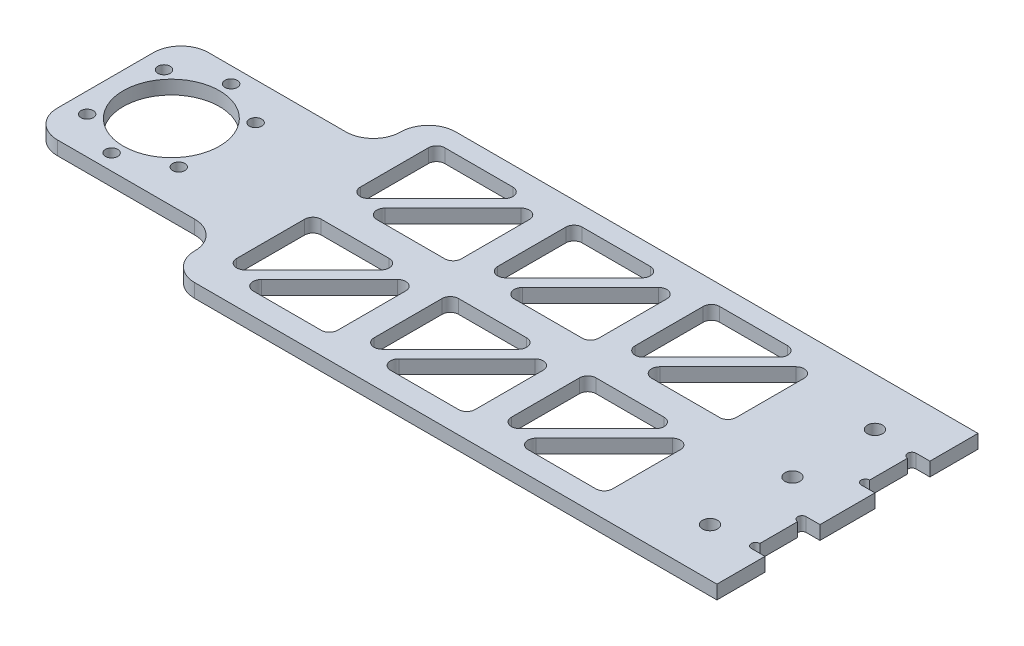
from build123d import *

# Parameters (mm, degrees)
SKETCH_1_W          = 270
SKETCH_1_H          = 5
EXTRUDE_1_DEPTH     = 95
SKETCH_2_R          = 2.25
SKETCH_2_R_2        = 17.5
CUT_EXTRUDE_1_DEPTH = 10
SKETCH_3_W          = 70
SKETCH_3_H          = 20
CUT_EXTRUDE_2_DEPTH = 10
FILLET_1_R          = 10
SKETCH_4_R          = 2.75
SKETCH_4_W          = 5
SKETCH_4_H          = 20
CUT_EXTRUDE_3_DEPTH = 10
SKETCH_5_R          = 1.55
CUT_EXTRUDE_4_DEPTH = 10


with BuildPart() as part:
    # 草图1 → 拉伸-薄壁1 (new body)
    with BuildSketch(Plane.XY):
        with Locations((-135, -2.5)):
            Rectangle(SKETCH_1_W, SKETCH_1_H)
    extrude(amount=EXTRUDE_1_DEPTH)

    # 草图2 → 切除-拉伸1 (cut)
    with BuildSketch(Plane(origin=(0, 0, 0), x_dir=(1, 0, 0), z_dir=(0, 1, 0))):
        with Locations(Location((-246, -25.75, 0), (0, 0, 270))):
            Circle(SKETCH_2_R)
        with Locations(Location((-229.338533362, -33.519369489, 0), (0, 0, 270))):
            Circle(SKETCH_2_R)
        with Locations(Location((-262.661466638, -33.519369489, 0), (0, 0, 270))):
            Circle(SKETCH_2_R)
        with Locations(Location((-262.661466638, -61.480630511, 0), (0, 0, 270))):
            Circle(SKETCH_2_R)
        with Locations(Location((-246, -69.25, 0), (0, 0, 270))):
            Circle(SKETCH_2_R)
        with Locations(Location((-229.338533362, -61.480630511, 0), (0, 0, 270))):
            Circle(SKETCH_2_R)
        with Locations(Location((-246, -47.5, 0), (0, 0, 270))):
            Circle(SKETCH_2_R_2)
    extrude(amount=-CUT_EXTRUDE_1_DEPTH, mode=Mode.SUBTRACT)

    # 草图3 → 切除-拉伸2 (cut)
    with BuildSketch(Plane(origin=(0, 0, 0), x_dir=(1, 0, 0), z_dir=(0, 1, 0))):
        with Locations((-235, -85)):
            Rectangle(SKETCH_3_W, SKETCH_3_H)
        with Locations((-235, -10)):
            Rectangle(SKETCH_3_W, SKETCH_3_H)
        with BuildLine():
            Line((-190, -10), (-190, -34.757359313))
            ThreePointArc((-190, -34.757359313), (-188.148050297, -37.52899791), (-184.878679656, -36.878679656))
            Line((-184.878679656, -36.878679656), (-160.121320344, -12.121320344))
            ThreePointArc((-160.121320344, -12.121320344), (-159.47100209, -8.851949703), (-162.242640687, -7))
            Line((-162.242640687, -7), (-187, -7))
            ThreePointArc((-187, -7), (-189.121320344, -7.878679656), (-190, -10))
        make_face()
        with BuildLine():
            Line((-154.121320344, -12.121320344), (-178.878679656, -36.878679656))
            ThreePointArc((-178.878679656, -36.878679656), (-179.52899791, -40.148050297), (-176.757359313, -42))
            Line((-176.757359313, -42), (-152, -42))
            ThreePointArc((-152, -42), (-149.878679656, -41.121320344), (-149, -39))
            Line((-149, -39), (-149, -14.242640687))
            ThreePointArc((-149, -14.242640687), (-150.851949703, -11.47100209), (-154.121320344, -12.121320344))
        make_face()
        with BuildLine():
            Line((-112.242640687, -7), (-137, -7))
            ThreePointArc((-137, -7), (-139.121320344, -7.878679656), (-140, -10))
            Line((-140, -10), (-140, -34.757359313))
            ThreePointArc((-140, -34.757359313), (-138.148050297, -37.52899791), (-134.878679656, -36.878679656))
            Line((-134.878679656, -36.878679656), (-110.121320344, -12.121320344))
            ThreePointArc((-110.121320344, -12.121320344), (-109.47100209, -8.851949703), (-112.242640687, -7))
        make_face()
        with BuildLine():
            Line((-99, -39), (-99, -14.242640687))
            ThreePointArc((-99, -14.242640687), (-100.851949703, -11.47100209), (-104.121320344, -12.121320344))
            Line((-104.121320344, -12.121320344), (-128.878679656, -36.878679656))
            ThreePointArc((-128.878679656, -36.878679656), (-129.52899791, -40.148050297), (-126.757359313, -42))
            Line((-126.757359313, -42), (-102, -42))
            ThreePointArc((-102, -42), (-99.878679656, -41.121320344), (-99, -39))
        make_face()
        with BuildLine():
            Line((-112.242640687, -52), (-137, -52))
            ThreePointArc((-137, -52), (-139.121320344, -52.878679656), (-140, -55))
            Line((-140, -55), (-140, -79.757359313))
            ThreePointArc((-140, -79.757359313), (-138.148050297, -82.52899791), (-134.878679656, -81.878679656))
            Line((-134.878679656, -81.878679656), (-110.121320344, -57.121320344))
            ThreePointArc((-110.121320344, -57.121320344), (-109.47100209, -53.851949703), (-112.242640687, -52))
        make_face()
        with BuildLine():
            Line((-99, -84), (-99, -59.242640687))
            ThreePointArc((-99, -59.242640687), (-100.851949703, -56.47100209), (-104.121320344, -57.121320344))
            Line((-104.121320344, -57.121320344), (-128.878679656, -81.878679656))
            ThreePointArc((-128.878679656, -81.878679656), (-129.52899791, -85.148050297), (-126.757359313, -87))
            Line((-126.757359313, -87), (-102, -87))
            ThreePointArc((-102, -87), (-99.878679656, -86.121320344), (-99, -84))
        make_face()
        with BuildLine():
            Line((-162.242640687, -52), (-187, -52))
            ThreePointArc((-187, -52), (-189.121320344, -52.878679656), (-190, -55))
            Line((-190, -55), (-190, -79.757359313))
            ThreePointArc((-190, -79.757359313), (-188.148050297, -82.52899791), (-184.878679656, -81.878679656))
            Line((-184.878679656, -81.878679656), (-160.121320344, -57.121320344))
            ThreePointArc((-160.121320344, -57.121320344), (-159.47100209, -53.851949703), (-162.242640687, -52))
        make_face()
        with BuildLine():
            Line((-149, -84), (-149, -59.242640687))
            ThreePointArc((-149, -59.242640687), (-150.851949703, -56.47100209), (-154.121320344, -57.121320344))
            Line((-154.121320344, -57.121320344), (-178.878679656, -81.878679656))
            ThreePointArc((-178.878679656, -81.878679656), (-179.52899791, -85.148050297), (-176.757359313, -87))
            Line((-176.757359313, -87), (-152, -87))
            ThreePointArc((-152, -87), (-149.878679656, -86.121320344), (-149, -84))
        make_face()
        with BuildLine():
            Line((-62.242640687, -7), (-87, -7))
            ThreePointArc((-87, -7), (-89.121320344, -7.878679656), (-90, -10))
            Line((-90, -10), (-90, -34.757359313))
            ThreePointArc((-90, -34.757359313), (-88.148050297, -37.52899791), (-84.878679656, -36.878679656))
            Line((-84.878679656, -36.878679656), (-60.121320344, -12.121320344))
            ThreePointArc((-60.121320344, -12.121320344), (-59.47100209, -8.851949703), (-62.242640687, -7))
        make_face()
        with BuildLine():
            Line((-49, -39), (-49, -14.242640687))
            ThreePointArc((-49, -14.242640687), (-50.851949703, -11.47100209), (-54.121320344, -12.121320344))
            Line((-54.121320344, -12.121320344), (-78.878679656, -36.878679656))
            ThreePointArc((-78.878679656, -36.878679656), (-79.52899791, -40.148050297), (-76.757359313, -42))
            Line((-76.757359313, -42), (-52, -42))
            ThreePointArc((-52, -42), (-49.878679656, -41.121320344), (-49, -39))
        make_face()
        with BuildLine():
            Line((-62.242640687, -52), (-87, -52))
            ThreePointArc((-87, -52), (-89.121320344, -52.878679656), (-90, -55))
            Line((-90, -55), (-90, -79.757359313))
            ThreePointArc((-90, -79.757359313), (-88.148050297, -82.52899791), (-84.878679656, -81.878679656))
            Line((-84.878679656, -81.878679656), (-60.121320344, -57.121320344))
            ThreePointArc((-60.121320344, -57.121320344), (-59.47100209, -53.851949703), (-62.242640687, -52))
        make_face()
        with BuildLine():
            Line((-49, -84), (-49, -59.242640687))
            ThreePointArc((-49, -59.242640687), (-50.851949703, -56.47100209), (-54.121320344, -57.121320344))
            Line((-54.121320344, -57.121320344), (-78.878679656, -81.878679656))
            ThreePointArc((-78.878679656, -81.878679656), (-79.52899791, -85.148050297), (-76.757359313, -87))
            Line((-76.757359313, -87), (-52, -87))
            ThreePointArc((-52, -87), (-49.878679656, -86.121320344), (-49, -84))
        make_face()
    extrude(amount=-CUT_EXTRUDE_2_DEPTH, mode=Mode.SUBTRACT)

    # 圆角1
    fillet_1_edges = [part.edges().sort_by_distance(p)[0] for p in [
        (-200, -2.5, 95),
        (-200, -2.5, 0),
        (-200, -2.5, 20),
        (-200, -2.5, 75),
        (-270, -2.5, 75),
        (-270, -2.5, 20),
    ]]
    fillet(fillet_1_edges, radius=FILLET_1_R - 0.0001)  # a hair under: the kernel refuses the full size

    # 草图4 → 切除-拉伸3 (cut)
    with BuildSketch(Plane(origin=(0, 0, 0), x_dir=(1, 0, 0), z_dir=(0, 1, 0))):
        with Locations(Location((-20, -17.5, 0), (0, 0, 270))):
            Circle(SKETCH_4_R)
        with Locations(Location((-20, -47.5, 0), (0, 0, 270))):
            Circle(SKETCH_4_R)
        with Locations(Location((-20, -77.5, 0), (0, 0, 270))):
            Circle(SKETCH_4_R)
        with Locations((-2.5, -67.5)):
            Rectangle(SKETCH_4_W, SKETCH_4_H)
        with Locations((-2.5, -27.5)):
            Rectangle(SKETCH_4_W, SKETCH_4_H)
    extrude(amount=-CUT_EXTRUDE_3_DEPTH, mode=Mode.SUBTRACT)

    # 草图5 → 切除-拉伸4 (cut)
    with BuildSketch(Plane(origin=(0, 0, 0), x_dir=(1, 0, 0), z_dir=(0, 1, 0))):
        with Locations((-5, -19.05)):
            Circle(SKETCH_5_R)
        with Locations((-5, -35.95)):
            Circle(SKETCH_5_R)
        with Locations((-5, -59.05)):
            Circle(SKETCH_5_R)
        with Locations((-5, -75.95)):
            Circle(SKETCH_5_R)
    extrude(amount=-CUT_EXTRUDE_4_DEPTH, mode=Mode.SUBTRACT)


solid = part.part
